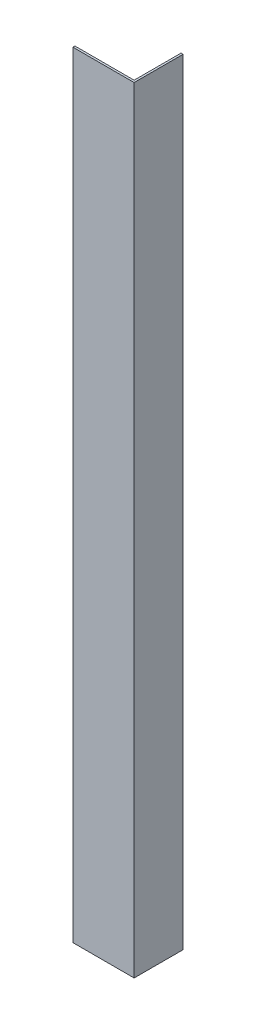
from build123d import *

# Parameters (mm, degrees)
BOSS_EXTRUDE1_DEPTH = 196
CUT_EXTRUDE3_REACH  = 198.939
SKETCH4_W           = 15
SKETCH4_H           = 3


with BuildPart() as part:
    # Sketch1 → Boss-Extrude1 (new body)
    with BuildSketch(Plane(origin=(0, 0, 0), x_dir=(1, 0, 0), z_dir=(0, 1, 0))):
        Polygon((0, 0), (15, 0), (15, 12), (14.5, 12), (14.5, 0.5), (0, 0.5), align=None)
    extrude(amount=BOSS_EXTRUDE1_DEPTH)

    # Sketch4 → Cut-Extrude3 (cut, up to next)
    with BuildSketch(Plane.XY, mode=Mode.PRIVATE) as cut_extrude3_sk1:
        with Locations((7.5, 194.5)):
            Rectangle(SKETCH4_W, SKETCH4_H)
    cut_extrude3_tool1 = extrude(cut_extrude3_sk1.sketch, amount=-CUT_EXTRUDE3_REACH, mode=Mode.PRIVATE) & part.part
    # Sketch4 → Cut-Extrude3 (cut, up to next)
    with BuildSketch(Plane.XY, mode=Mode.PRIVATE) as cut_extrude3_sk2:
        with Locations((7.5, 1.5)):
            Rectangle(SKETCH4_W, SKETCH4_H)
    cut_extrude3_tool2 = extrude(cut_extrude3_sk2.sketch, amount=-CUT_EXTRUDE3_REACH, mode=Mode.PRIVATE) & part.part
    add(cut_extrude3_tool1.solids().sort_by_distance((7.5, 194.5, 0))[0], mode=Mode.SUBTRACT)
    add(cut_extrude3_tool2.solids().sort_by_distance((7.5, 1.5, 0))[0], mode=Mode.SUBTRACT)


solid = part.part
